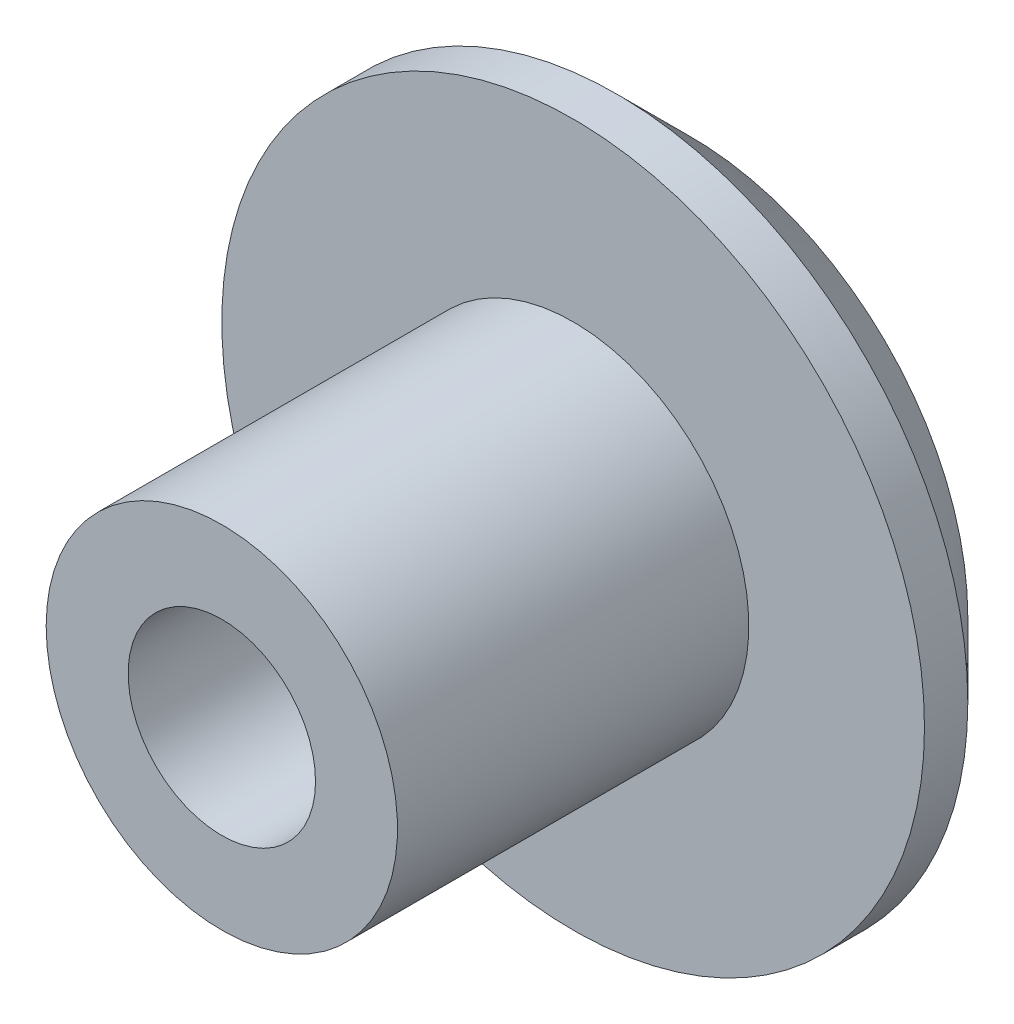
from build123d import *

# Parameters (mm, degrees)
SKETCH1_R           = 4.7625
BOSS_EXTRUDE1_DEPTH = 1.5875
SKETCH3_R           = 2.38125
BOSS_EXTRUDE2_DEPTH = 4.7625
SKETCH4_R           = 1.27
CUT_EXTRUDE1_DEPTH  = 10.256636133
CHAMFER2_SIZE       = 1


with BuildPart() as part:
    # Sketch1 → Boss-Extrude1 (new body)
    with BuildSketch(Plane.XY):
        Circle(SKETCH1_R)
    extrude(amount=BOSS_EXTRUDE1_DEPTH)

    # Sketch3 → Boss-Extrude2 (add)
    with BuildSketch(Plane.XY.offset(1.5875)):
        Circle(SKETCH3_R)
    extrude(amount=BOSS_EXTRUDE2_DEPTH)

    # Sketch4 → Cut-Extrude1 (cut, through all)
    with BuildSketch(Plane.XY.offset(6.35)):
        Circle(SKETCH4_R)
    extrude(amount=-CUT_EXTRUDE1_DEPTH, mode=Mode.SUBTRACT)

    # Chamfer2
    chamfer2_edges = [part.edges().sort_by_distance(p)[0] for p in [
        (-4.7625, 0, 0),
    ]]
    chamfer(chamfer2_edges, length=CHAMFER2_SIZE)


solid = part.part
